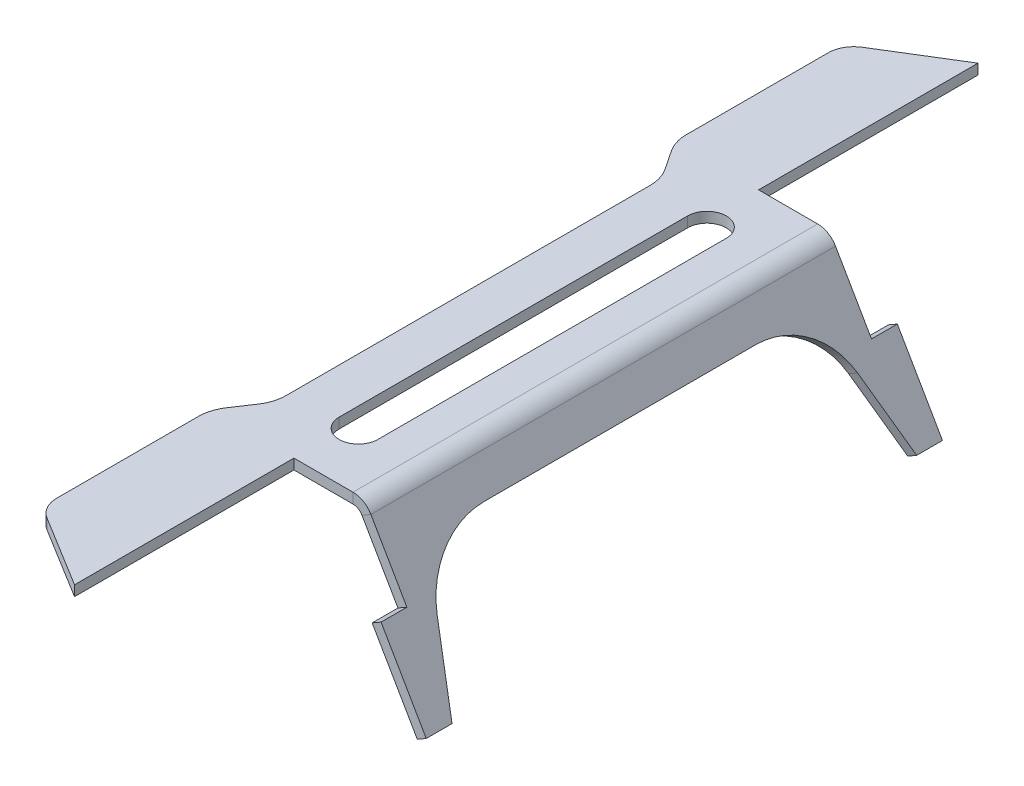
from build123d import *

# Parameters (mm, degrees)
SM_BASE_FLANGE_1_DEPTH = 350
CUT_EXTRUDE_1_DEPTH    = 10
CUT_EXTRUDE_2_DEPTH    = 10
CUT_EXTRUDE_START      = 180
CUT_EXTRUDE_3_DEPTH    = 170
CUT_EXTRUDE_4_DEPTH    = 10
SKETCH_10_W            = 150
SKETCH_10_H            = 123.452994616
CUT_EXTRUDE_5_DEPTH    = 10
SKETCH_11_W            = 20
SKETCH_11_H            = 53.452994616
CUT_EXTRUDE_6_DEPTH    = 10
CUT_EXTRUDE_7_DEPTH    = 10
FILLET_1_R             = 60
FILLET_2_R             = 30
FILLET_3_R             = 20


# Read off the part's stored shape, not the designer's step: 切除-拉伸3
# Sheet-metal steps are written as plain solids
with BuildPart() as part:
    # Sketch 1 → 基体-法兰1 (new, symmetric)
    with BuildSketch(Plane.XY):
        with BuildLine():
            Line((-120, 0), (-9.237604307, 0))
            ThreePointArc((-9.237604307, 0), (-1.237604307, -2.143593539), (4.618802154, -8))
            Line((4.618802154, -8), (67.5, -116.913429511))
            Line((67.5, -116.913429511), (60.57179677, -120.913429511))
            Line((60.57179677, -120.913429511), (-2.309401077, -12))
            ThreePointArc((-2.309401077, -12), (-5.237604307, -9.07179677), (-9.237604307, -8))
            Line((-9.237604307, -8), (-120, -8))
            Line((-120, -8), (-120, 0))
        make_face()
    extrude(amount=SM_BASE_FLANGE_1_DEPTH, both=True)

    # 草图6 → 切除-拉伸1 (cut)
    with BuildSketch(Plane(origin=(0, 0, 0), x_dir=(1, 0, 0), z_dir=(0, 1, 0))):
        Polygon((-120, -180), (-120, 180), (-100, 150), (-100, -150), align=None)
    extrude(amount=-CUT_EXTRUDE_1_DEPTH, mode=Mode.SUBTRACT)

    # 草图7 → 切除-拉伸2 (cut)
    with BuildSketch(Plane(origin=(0, 0, 0), x_dir=(1, 0, 0), z_dir=(0, 1, 0))):
        with BuildLine():
            Line((-65, -135), (-65, 135))
            ThreePointArc((-65, 135), (-50, 150), (-35, 135))
            Line((-35, 135), (-35, -135))
            ThreePointArc((-35, -135), (-50, -150), (-65, -135))
        make_face()
    extrude(amount=-CUT_EXTRUDE_2_DEPTH, mode=Mode.SUBTRACT)

    # 切除-拉伸3 outline → 切除-拉伸3 (cut)
    with BuildSketch(Plane.XY.offset(CUT_EXTRUDE_START)):
        with BuildLine():
            Line((-2.309401077, -12), (-1.154700538, -14))
            Line((-1.154700538, -14), (5.773502692, -10))
            Line((5.773502692, -10), (4.618802154, -8))
            ThreePointArc((4.618802154, -8), (-1.237604307, -2.143593539), (-9.237604307, 0))
            Line((-9.237604307, 0), (-55, 0))
            Line((-55, 0), (-55, -8))
            Line((-55, -8), (-9.237604307, -8))
            ThreePointArc((-9.237604307, -8), (-5.237604307, -9.07179677), (-2.309401077, -12))
        make_face()
    cut_extrude_3 = extrude(amount=CUT_EXTRUDE_3_DEPTH, mode=Mode.SUBTRACT)

    # 草图9 → 切除-拉伸4 (cut)
    with BuildSketch(Plane(origin=(0, 0, 0), x_dir=(1, 0, 0), z_dir=(0, 1, 0))):
        Polygon((-120, -350), (-120, -310), (-55, -350), align=None)
    cut_extrude_4 = extrude(amount=-CUT_EXTRUDE_4_DEPTH, mode=Mode.SUBTRACT)

    # 草图10 → 切除-拉伸5 (cut)
    with BuildSketch(Plane(origin=(0, 0, 0), x_dir=(0, 0, -1), z_dir=(0.8660254037844398, 0.49999999999999806, 0))):
        with Locations((-275, -73.273502692)):
            Rectangle(SKETCH_10_W, SKETCH_10_H)
    cut_extrude_5 = extrude(amount=-CUT_EXTRUDE_5_DEPTH, mode=Mode.SUBTRACT)

    # 草图11 → 切除-拉伸6 (cut)
    with BuildSketch(Plane(origin=(0, 0, 0), x_dir=(0, 0, -1), z_dir=(0.8660254037844398, 0.49999999999999806, 0))):
        with Locations((-190, -38.273502692)):
            Rectangle(SKETCH_11_W, SKETCH_11_H)
    cut_extrude_6 = extrude(amount=-CUT_EXTRUDE_6_DEPTH, mode=Mode.SUBTRACT)

    # 镜向1: 切除-拉伸4, 切除-拉伸5 across plane
    add(cut_extrude_4.mirror(Plane.XY), mode=Mode.SUBTRACT)
    add(cut_extrude_5.mirror(Plane.XY), mode=Mode.SUBTRACT)

    # 镜向2: 切除-拉伸3 across plane
    add(cut_extrude_3.mirror(Plane.XY), mode=Mode.SUBTRACT)

    # 镜向3: 切除-拉伸6 across plane
    add(cut_extrude_6.mirror(Plane.XY), mode=Mode.SUBTRACT)

    # 草图12 → 切除-拉伸7 (cut)
    with BuildSketch(Plane(origin=(0, 0, 0), x_dir=(0, 0, -1), z_dir=(0.8660254037844398, 0.49999999999999806, 0))):
        Polygon((-150, -35), (150, -35), (180, -135), (-180, -135), align=None)
    extrude(amount=-CUT_EXTRUDE_7_DEPTH, mode=Mode.SUBTRACT)

    # 圆角1
    fillet_1_edges = [part.edges().sort_by_distance(p)[0] for p in [
        (14.035898385, -32.310889132, 150),
        (14.035898385, -32.310889132, -150),
    ]]
    fillet(fillet_1_edges, radius=FILLET_1_R)

    # 圆角2
    fillet_2_edges = [part.edges().sort_by_distance(p)[0] for p in [
        (-120, -4, -180),
        (-100, -4, -150),
        (-100, -4, 150),
        (-120, -4, 180),
    ]]
    fillet(fillet_2_edges, radius=FILLET_2_R)

    # 圆角3
    fillet_3_edges = [part.edges().sort_by_distance(p)[0] for p in [
        (-120, -4, 310),
        (-120, -4, -310),
    ]]
    fillet(fillet_3_edges, radius=FILLET_3_R)


solid = part.part
